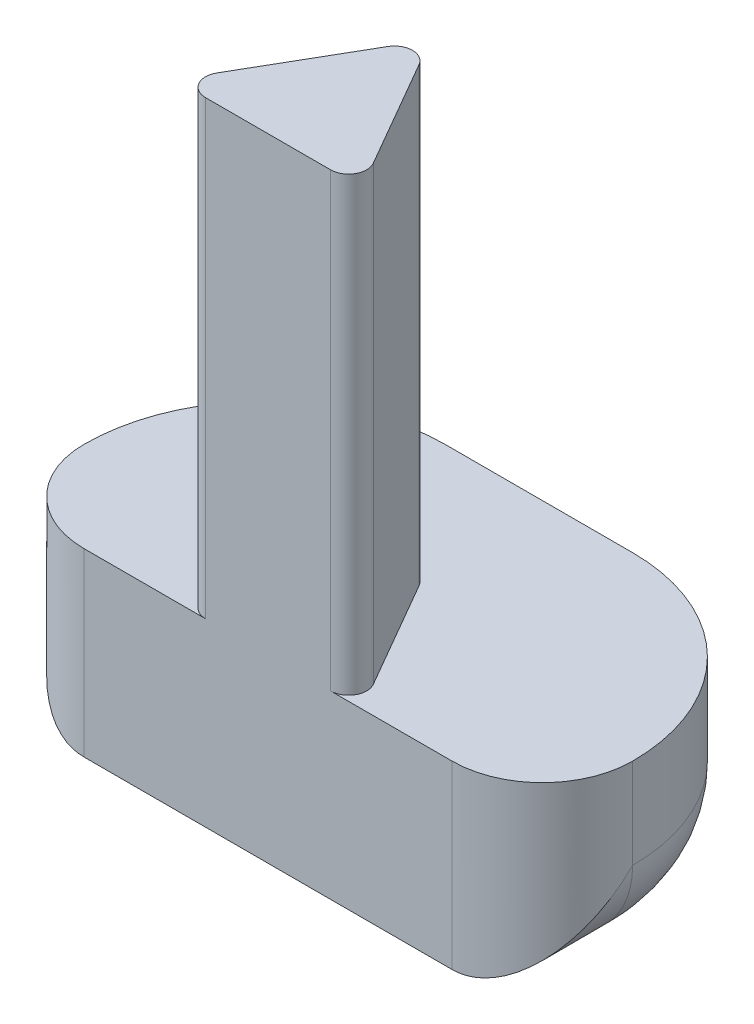
from build123d import *

# Parameters (mm, degrees)
BOSS_EXTRUDE1_DEPTH = 5
BOSS_EXTRUDE2_DEPTH = 2
FILLET1_R           = 1
FILLET2_R           = 0.2


with BuildPart() as part:
    # Sketch2 → Boss-Extrude1 (new body)
    with BuildSketch(Plane(origin=(0, 0, 0), x_dir=(1, 0, 0), z_dir=(0, 1, 0))):
        Polygon((0, 0), (-2.078460969, 0), (-1.039230485, 1.8), align=None)
    extrude(amount=BOSS_EXTRUDE1_DEPTH)

    # Sketch3 → Boss-Extrude2 (add)
    with BuildSketch(Plane.XZ):
        with BuildLine():
            Line((-4.078460969, 0), (2, 0))
            Line((2, 0), (2, -1))
            ThreePointArc((2, -1), (1.414213562, -2.414213562), (0, -3))
            Line((0, -3), (-2.078460969, -3))
            ThreePointArc((-2.078460969, -3), (-3.492674531, -2.414213562), (-4.078460969, -1))
            Line((-4.078460969, -1), (-4.078460969, 0))
        make_face()
    extrude(amount=BOSS_EXTRUDE2_DEPTH)

    # Fillet1
    fillet1_edges = [part.edges().sort_by_distance(p)[0] for p in [
        (-4.078460969, -2, -0.5),
        (-3.492674531, -2, -2.414213562),
        (-1.039230485, -2, -3),
        (2, -2, -0.5),
        (1.414213562, -2, -2.414213562),
        (-4.078460969, -1, 0),
        (2, -1, 0),
    ]]
    fillet(fillet1_edges, radius=FILLET1_R - 0.0001)  # a hair under: the kernel refuses the full size

    # Fillet2
    fillet2_edges = [part.edges().sort_by_distance(p)[0] for p in [
        (0, 2.5, 0),
        (-2.078460969, 2.5, 0),
        (-1.039230485, 2.5, -1.8),
    ]]
    fillet(fillet2_edges, radius=FILLET2_R)


solid = part.part
